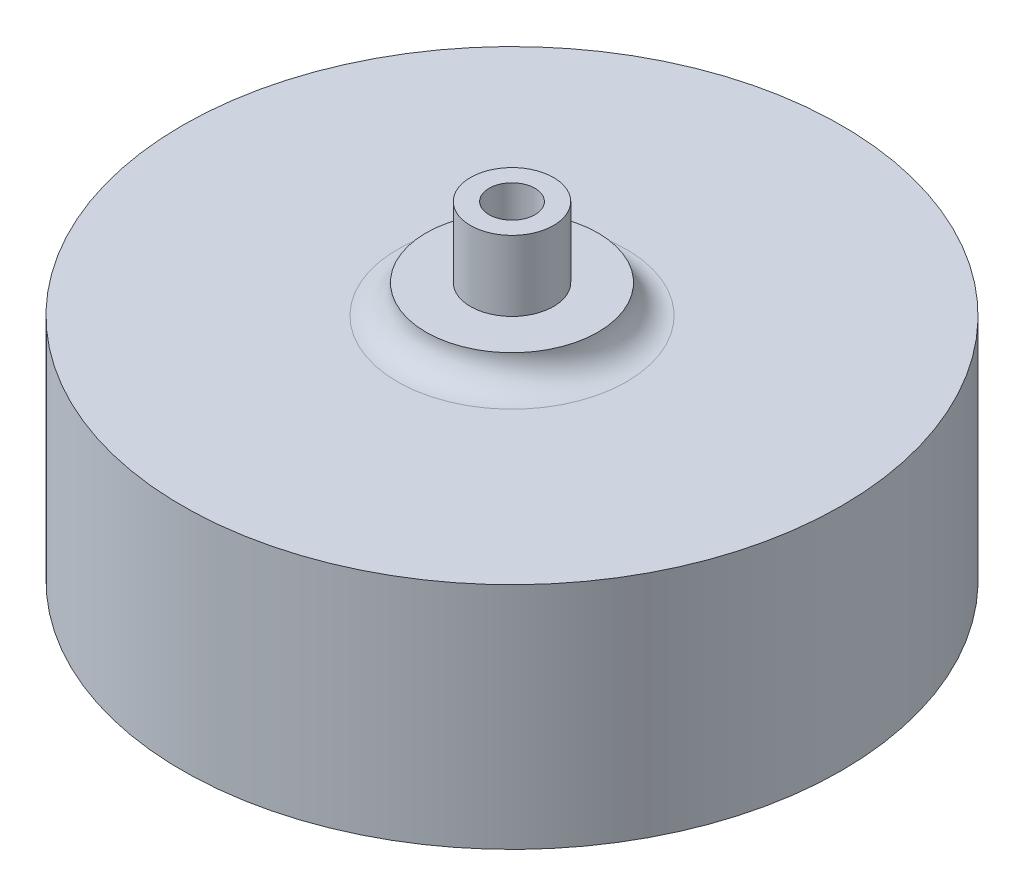
from build123d import *

# Parameters (mm, degrees)
FILLET_1_R = 2


with BuildPart() as part:
    # 草图1 → 旋转1 (revolve)
    with BuildSketch(Plane.XY, mode=Mode.PRIVATE) as revolve_1_sk:
        Polygon((0, 0), (1.3, 0), (1.3, -4.9), (4.4, -4.9), (4.4, -6.9), (21.4, -6.9), (21.4, -22.9), (4.4, -22.9), (4.4, -24.9), (1.3, -24.9), (1.3, -29.8), (0, -29.8), align=None)
    revolve(revolve_1_sk.sketch.rotate(Axis((-1.6, 5.739994567, 0), (0, -1, 0)), 180), axis=Axis((-1.6, 5.739994567, 0), (0, -1, 0)))

    # 圆角1
    fillet_1_edges = [part.edges().sort_by_distance(p)[0] for p in [
        (4.4, -22.9, 0),
        (4.4, -6.9, 0),
    ]]
    fillet(fillet_1_edges, radius=FILLET_1_R - 0.0001)  # a hair under: the kernel refuses the full size


solid = part.part
